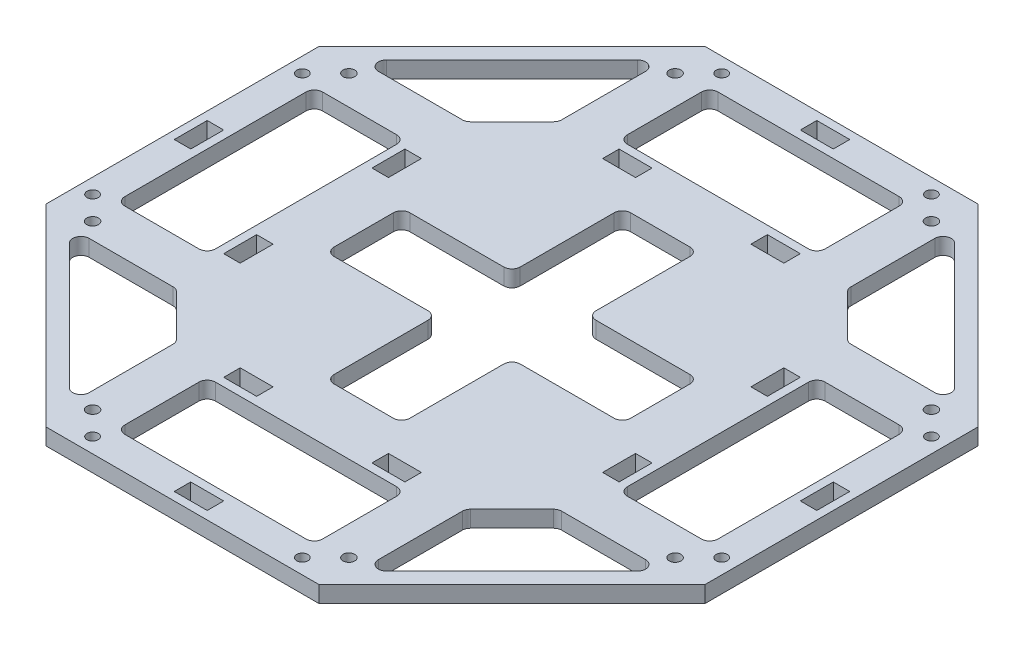
from build123d import *

# Parameters (mm, degrees)
BASE_DEPTH                                 = 6.35
WHEEL_CUTOUT_REACH                         = 181.717
SKETCH3_W                                  = 76.2
SKETCH3_H                                  = 34.925
WHEEL_CUTOUT_FILLETS_R                     = 3.175
WHEEL_CUTOUT_PATTERN_COUNT                 = 4
WHEEL_CUTOUT_FILLETS_OF_WHEEL_CUTOUT_PAT_R = 3.175
SUPPORT_CUTOUTS_REACH                      = 181.717
SKETCH4_W                                  = 12.7
SKETCH4_H                                  = 6.35
SUPPORT_CUTOUT_PATTERN_COUNT               = 4
MOTOR_CLEARANCE_DEPTH                      = 180.717340566
CIRPATTERN1_COUNT                          = 4
FILLET1_R                                  = 3.175
ALIGNER_HOLE_SKETCH_R                      = 2.2479
ALIGNER_HOLES_DEPTH                        = 180.717340566
ALIGNER_HOLE_PATTERN_COUNT                 = 4
SKETCH7_R                                  = 2.15265
CUT_EXTRUDE2_DEPTH                         = 180.717340566
ALIGHER_LIGHTENNING_HOLES_DEPTH            = 180.717340566
CIRPATTERN3_COUNT                          = 4


with BuildPart() as part:
    # Base sketch → Base (new body)
    with BuildSketch(Plane(origin=(0, 0, 0), x_dir=(1, 0, 0), z_dir=(0, 1, 0))):
        Polygon((-127, 52.605122421), (-127, -52.605122421), (-52.605122421, -127), (52.605122421, -127), (127, -52.605122421), (127, 52.605122421), (52.605122421, 127), (-52.605122421, 127), align=None)
    extrude(amount=BASE_DEPTH)

    # Sketch3 → Wheel cutout (cut, up to next)
    with BuildSketch(Plane(origin=(0, 6.35, 0), x_dir=(1, 0, 0), z_dir=(0, 1, 0)), mode=Mode.PRIVATE) as wheel_cutout_sk1:
        with Locations((0, 96.8375)):
            Rectangle(SKETCH3_W, SKETCH3_H)
    wheel_cutout_tool1 = extrude(wheel_cutout_sk1.sketch, amount=-WHEEL_CUTOUT_REACH, mode=Mode.PRIVATE) & part.part
    wheel_cutout = wheel_cutout_tool1.solids().sort_by_distance((0, 6.35, -96.8375))[0]
    add(wheel_cutout, mode=Mode.SUBTRACT)

    # Wheel cutout fillets
    wheel_cutout_fillets_edges = [part.edges().sort_by_distance(p)[0] for p in [
        (38.1, 3.175, -114.3),
        (38.1, 3.175, -79.375),
        (-38.1, 3.175, -79.375),
        (-38.1, 3.175, -114.3),
    ]]
    fillet(wheel_cutout_fillets_edges, radius=WHEEL_CUTOUT_FILLETS_R)

    # Wheel cutout pattern: Wheel cutout ×4 about axis
    wheel_cutout_pattern_axis = Axis((0, -0.29972, 0), (0, 1, 0))
    for i in range(1, WHEEL_CUTOUT_PATTERN_COUNT):
        add(wheel_cutout.rotate(wheel_cutout_pattern_axis, i * 360 / WHEEL_CUTOUT_PATTERN_COUNT), mode=Mode.SUBTRACT)

    # Wheel cutout fillets of Wheel cutout pat
    wheel_cutout_fillets_of_wheel_cutout_pat_edges = [part.edges().sort_by_distance(p)[0] for p in [
        (-114.3, 3.175, -38.1),
        (-79.375, 3.175, -38.1),
        (-79.375, 3.175, 38.1),
        (-114.3, 3.175, 38.1),
        (-38.1, 3.175, 114.3),
        (-38.1, 3.175, 79.375),
        (38.1, 3.175, 79.375),
        (38.1, 3.175, 114.3),
        (114.3, 3.175, 38.1),
        (79.375, 3.175, 38.1),
        (79.375, 3.175, -38.1),
        (114.3, 3.175, -38.1),
    ]]
    fillet(wheel_cutout_fillets_of_wheel_cutout_pat_edges, radius=WHEEL_CUTOUT_FILLETS_OF_WHEEL_CUTOUT_PAT_R)

    # Sketch4 → Support cutouts (cut, up to next)
    with BuildSketch(Plane(origin=(0, 6.35, 0), x_dir=(1, 0, 0), z_dir=(0, 1, 0)), mode=Mode.PRIVATE) as support_cutouts_sk1:
        with Locations((28.575, 73.025)):
            Rectangle(SKETCH4_W, SKETCH4_H)
    support_cutouts_tool1 = extrude(support_cutouts_sk1.sketch, amount=-SUPPORT_CUTOUTS_REACH, mode=Mode.PRIVATE) & part.part
    # Sketch4 → Support cutouts (cut, up to next)
    with BuildSketch(Plane(origin=(0, 6.35, 0), x_dir=(1, 0, 0), z_dir=(0, 1, 0)), mode=Mode.PRIVATE) as support_cutouts_sk2:
        with Locations((-28.575, 73.025)):
            Rectangle(SKETCH4_W, SKETCH4_H)
    support_cutouts_tool2 = extrude(support_cutouts_sk2.sketch, amount=-SUPPORT_CUTOUTS_REACH, mode=Mode.PRIVATE) & part.part
    # Sketch4 → Support cutouts (cut, up to next)
    with BuildSketch(Plane(origin=(0, 6.35, 0), x_dir=(1, 0, 0), z_dir=(0, 1, 0)), mode=Mode.PRIVATE) as support_cutouts_sk3:
        with Locations((0, 120.65)):
            Rectangle(SKETCH4_W, SKETCH4_H)
    support_cutouts_tool3 = extrude(support_cutouts_sk3.sketch, amount=-SUPPORT_CUTOUTS_REACH, mode=Mode.PRIVATE) & part.part
    support_cutouts_1 = support_cutouts_tool1.solids().sort_by_distance((28.575, 6.35, -73.025))[0]
    add(support_cutouts_1, mode=Mode.SUBTRACT)
    support_cutouts_2 = support_cutouts_tool2.solids().sort_by_distance((-28.575, 6.35, -73.025))[0]
    add(support_cutouts_2, mode=Mode.SUBTRACT)
    support_cutouts_3 = support_cutouts_tool3.solids().sort_by_distance((0, 6.35, -120.65))[0]
    add(support_cutouts_3, mode=Mode.SUBTRACT)
    support_cutouts = support_cutouts_1 + support_cutouts_2 + support_cutouts_3  # Support cutouts as one shape, for the pattern or mirror that repeats it

    # Support cutout pattern: Support cutouts ×4 about axis
    support_cutout_pattern_axis = Axis((0, -0.29972, 0), (0, 1, 0))
    for i in range(1, SUPPORT_CUTOUT_PATTERN_COUNT):
        add(support_cutouts.rotate(support_cutout_pattern_axis, i * 360 / SUPPORT_CUTOUT_PATTERN_COUNT), mode=Mode.SUBTRACT)

    # Sketch5 → Motor Clearance (cut, through all)
    with BuildSketch(Plane(origin=(0, 6.35, 0), x_dir=(1, 0, 0), z_dir=(0, 1, 0))):
        Polygon((14.605, 57.15), (-14.605, 57.15), (-14.605, 14.605), (0, 0), (14.605, 14.605), align=None)
    motor_clearance = extrude(amount=-MOTOR_CLEARANCE_DEPTH, mode=Mode.SUBTRACT)

    # CirPattern1: Motor Clearance ×4 about axis
    cirpattern1_axis = Axis((0, -0.29972, 0), (0, 1, 0))
    for i in range(1, CIRPATTERN1_COUNT):
        add(motor_clearance.rotate(cirpattern1_axis, i * 360 / CIRPATTERN1_COUNT), mode=Mode.SUBTRACT)

    # Fillet1
    fillet1_edges = [part.edges().sort_by_distance(p)[0] for p in [
        (-14.605, 3.175, 57.15),
        (-57.15, 3.175, 14.605),
        (14.605, 3.175, 57.15),
        (-14.605, 3.175, 14.605),
        (14.605, 3.175, 14.605),
        (14.605, 3.175, -14.605),
        (57.15, 3.175, 14.605),
        (57.15, 3.175, -14.605),
        (14.605, 3.175, -57.15),
        (-14.605, 3.175, -14.605),
        (-14.605, 3.175, -57.15),
        (-57.15, 3.175, -14.605),
    ]]
    fillet(fillet1_edges, radius=FILLET1_R)

    # Aligner hole sketch → Aligner holes (cut, through all)
    with BuildSketch(Plane(origin=(0, 6.35, 0), x_dir=(1, 0, 0), z_dir=(0, 1, 0))):
        with Locations((-49.391408666, 112.253201513)):
            Circle(ALIGNER_HOLE_SKETCH_R)
        with Locations((-112.253201513, 49.391408666)):
            Circle(ALIGNER_HOLE_SKETCH_R)
    aligner_holes = extrude(amount=-ALIGNER_HOLES_DEPTH, mode=Mode.SUBTRACT)

    # Aligner hole pattern: Aligner holes ×4 about axis
    aligner_hole_pattern_axis = Axis((0, -0.29972, 0), (0, 1, 0))
    for i in range(1, ALIGNER_HOLE_PATTERN_COUNT):
        add(aligner_holes.rotate(aligner_hole_pattern_axis, i * 360 / ALIGNER_HOLE_PATTERN_COUNT), mode=Mode.SUBTRACT)

    # Sketch7 → Cut-Extrude2 (cut, through all)
    with BuildSketch(Plane(origin=(0, 6.35, 0), x_dir=(1, 0, 0), z_dir=(0, 1, 0))):
        with Locations((121.233457634, 40.411152545)):
            Circle(SKETCH7_R)
        with Locations((121.233457634, -40.411152545)):
            Circle(SKETCH7_R)
        with Locations((40.411152545, -121.233457634)):
            Circle(SKETCH7_R)
        with Locations((-40.411152545, -121.233457634)):
            Circle(SKETCH7_R)
        with Locations((-121.233457634, -40.411152545)):
            Circle(SKETCH7_R)
        with Locations((-121.233457634, 40.411152545)):
            Circle(SKETCH7_R)
        with Locations((-40.411152545, 121.233457634)):
            Circle(SKETCH7_R)
        with Locations((40.411152545, 121.233457634)):
            Circle(SKETCH7_R)
    extrude(amount=-CUT_EXTRUDE2_DEPTH, mode=Mode.SUBTRACT)

    # Sketch8 → Aligher Lightenning holes (cut, through all)
    with BuildSketch(Plane(origin=(0, 6.35, 0), x_dir=(1, 0, 0), z_dir=(0, 1, 0))):
        with BuildLine():
            Line((-109.463393604, 61.161472696), (-61.161472696, 109.463393604))
            ThreePointArc((-61.161472696, 109.463393604), (-57.701388768, 110.15164709), (-55.741408666, 107.218329574))
            Line((-55.741408666, 107.218329574), (-55.741408666, 74.889407538))
            ThreePointArc((-55.741408666, 74.889407538), (-55.98309115, 73.67438764), (-56.671344636, 72.644343508))
            Line((-56.671344636, 72.644343508), (-72.644343508, 56.671344636))
            ThreePointArc((-72.644343508, 56.671344636), (-73.67438764, 55.98309115), (-74.889407538, 55.741408666))
            Line((-74.889407538, 55.741408666), (-107.218329574, 55.741408666))
            ThreePointArc((-107.218329574, 55.741408666), (-110.15164709, 57.701388768), (-109.463393604, 61.161472696))
        make_face()
    aligher_lightenning_holes = extrude(amount=-ALIGHER_LIGHTENNING_HOLES_DEPTH, mode=Mode.SUBTRACT)

    # CirPattern3: Aligher Lightenning holes ×4 about axis
    cirpattern3_axis = Axis((0, -0.29972, 0), (0, 1, 0))
    for i in range(1, CIRPATTERN3_COUNT):
        add(aligher_lightenning_holes.rotate(cirpattern3_axis, i * 360 / CIRPATTERN3_COUNT), mode=Mode.SUBTRACT)


solid = part.part
